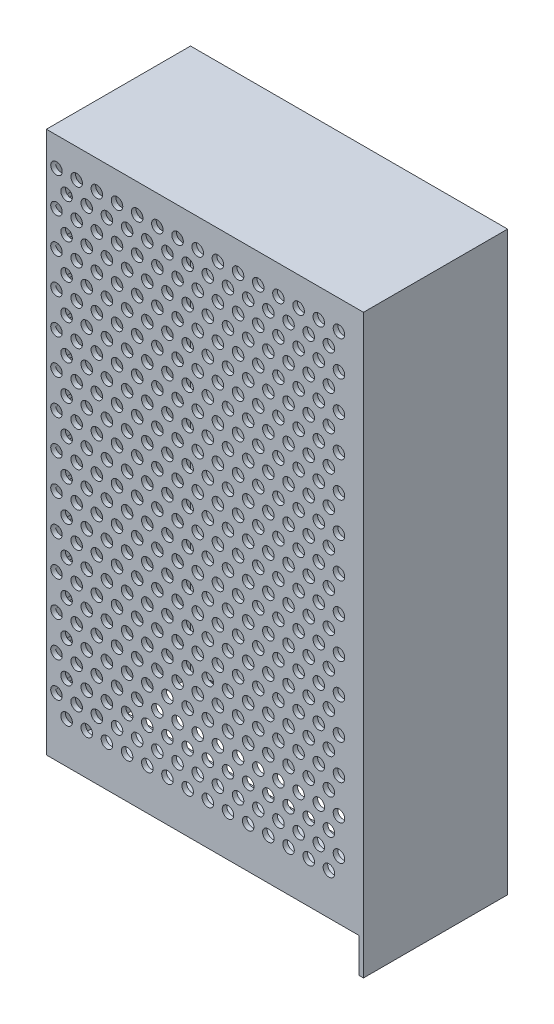
from build123d import *

# Parameters (mm, degrees)
SKETCH1_W           = 110
SKETCH1_H           = 200
BOSS_EXTRUDE1_DEPTH = 50
SHELL1_T            = -1.6
CUT_EXTRUDE1_DEPTH  = 48.4
SKETCH3_W           = 110
SKETCH3_H           = 1.6
BOSS_EXTRUDE2_DEPTH = 25
SKETCH5_R           = 1.5
CUT_EXTRUDE3_DEPTH  = 1.6
SKETCH6_R           = 2
CUT_EXTRUDE4_DEPTH  = 10


with BuildPart() as part:
    # Sketch1 → Boss-Extrude1 (new body)
    with BuildSketch(Plane.XY):
        Rectangle(SKETCH1_W, SKETCH1_H)
    extrude(amount=BOSS_EXTRUDE1_DEPTH)

    # Shell1
    shell1_openings = [part.faces().sort_by_distance(p)[0] for p in [
        (0, -100, 25),
    ]]
    offset(amount=SHELL1_T, openings=shell1_openings, kind=Kind.INTERSECTION)

    # Sketch2 → Cut-Extrude1 (cut)
    with BuildSketch(Plane.XY.offset(50)):
        Polygon((-53.4, -100), (53.4, -100), (53.4, -88), (-53.4, -88), (-55, -88), (-55, -100), align=None)
    extrude(amount=-CUT_EXTRUDE1_DEPTH, mode=Mode.SUBTRACT)

    # Sketch3 → Boss-Extrude2 (add)
    with BuildSketch(Plane.XY.offset(50)):
        with Locations((0, -87.2)):
            Rectangle(SKETCH3_W, SKETCH3_H)
    extrude(amount=-BOSS_EXTRUDE2_DEPTH)

    # Sketch5 → Cut-Extrude3 (cut)
    with BuildSketch(Plane(origin=(0, 0, 0), x_dir=(-1, 0, 0), z_dir=(0, 0, -1))):
        with Locations((-46, 90)):
            Circle(SKETCH5_R)
        with Locations((46, 90)):
            Circle(SKETCH5_R)
        with Locations((-46, -87)):
            Circle(SKETCH5_R)
        with Locations((46, -87)):
            Circle(SKETCH5_R)
    extrude(amount=-CUT_EXTRUDE3_DEPTH, mode=Mode.SUBTRACT)

    # Sketch6 → Cut-Extrude4 (cut)
    with BuildSketch(Plane.XY.offset(50)):
        with Locations((-51.5, 90)):
            Circle(SKETCH6_R)
        with Locations((-44.5, 90)):
            Circle(SKETCH6_R)
        with Locations((-37.5, 90)):
            Circle(SKETCH6_R)
        with Locations((-30.5, 90)):
            Circle(SKETCH6_R)
        with Locations((-23.5, 90)):
            Circle(SKETCH6_R)
        with Locations((-16.5, 90)):
            Circle(SKETCH6_R)
        with Locations((-9.5, 90)):
            Circle(SKETCH6_R)
        with Locations((-2.5, 90)):
            Circle(SKETCH6_R)
        with Locations((4.5, 90)):
            Circle(SKETCH6_R)
        with Locations((11.5, 90)):
            Circle(SKETCH6_R)
        with Locations((18.5, 90)):
            Circle(SKETCH6_R)
        with Locations((25.5, 90)):
            Circle(SKETCH6_R)
        with Locations((32.5, 90)):
            Circle(SKETCH6_R)
        with Locations((39.5, 90)):
            Circle(SKETCH6_R)
        with Locations((46.5, 90)):
            Circle(SKETCH6_R)
        with Locations((-48, 83.937822174)):
            Circle(SKETCH6_R)
        with Locations((-41, 83.937822174)):
            Circle(SKETCH6_R)
        with Locations((-34, 83.937822174)):
            Circle(SKETCH6_R)
        with Locations((-27, 83.937822174)):
            Circle(SKETCH6_R)
        with Locations((-20, 83.937822174)):
            Circle(SKETCH6_R)
        with Locations((-13, 83.937822174)):
            Circle(SKETCH6_R)
        with Locations((-6, 83.937822174)):
            Circle(SKETCH6_R)
        with Locations((1, 83.937822174)):
            Circle(SKETCH6_R)
        with Locations((8, 83.937822174)):
            Circle(SKETCH6_R)
        with Locations((15, 83.937822174)):
            Circle(SKETCH6_R)
        with Locations((22, 83.937822174)):
            Circle(SKETCH6_R)
        with Locations((29, 83.937822174)):
            Circle(SKETCH6_R)
        with Locations((36, 83.937822174)):
            Circle(SKETCH6_R)
        with Locations((43, 83.937822174)):
            Circle(SKETCH6_R)
        with Locations((-51.5, 77.875644347)):
            Circle(SKETCH6_R)
        with Locations((-44.5, 77.875644347)):
            Circle(SKETCH6_R)
        with Locations((-37.5, 77.875644347)):
            Circle(SKETCH6_R)
        with Locations((-30.5, 77.875644347)):
            Circle(SKETCH6_R)
        with Locations((-23.5, 77.875644347)):
            Circle(SKETCH6_R)
        with Locations((-16.5, 77.875644347)):
            Circle(SKETCH6_R)
        with Locations((-9.5, 77.875644347)):
            Circle(SKETCH6_R)
        with Locations((-2.5, 77.875644347)):
            Circle(SKETCH6_R)
        with Locations((4.5, 77.875644347)):
            Circle(SKETCH6_R)
        with Locations((11.5, 77.875644347)):
            Circle(SKETCH6_R)
        with Locations((18.5, 77.875644347)):
            Circle(SKETCH6_R)
        with Locations((25.5, 77.875644347)):
            Circle(SKETCH6_R)
        with Locations((32.5, 77.875644347)):
            Circle(SKETCH6_R)
        with Locations((39.5, 77.875644347)):
            Circle(SKETCH6_R)
        with Locations((46.5, 77.875644347)):
            Circle(SKETCH6_R)
        with Locations((-48, 71.813466521)):
            Circle(SKETCH6_R)
        with Locations((-41, 71.813466521)):
            Circle(SKETCH6_R)
        with Locations((-34, 71.813466521)):
            Circle(SKETCH6_R)
        with Locations((-27, 71.813466521)):
            Circle(SKETCH6_R)
        with Locations((-20, 71.813466521)):
            Circle(SKETCH6_R)
        with Locations((-13, 71.813466521)):
            Circle(SKETCH6_R)
        with Locations((-6, 71.813466521)):
            Circle(SKETCH6_R)
        with Locations((1, 71.813466521)):
            Circle(SKETCH6_R)
        with Locations((8, 71.813466521)):
            Circle(SKETCH6_R)
        with Locations((15, 71.813466521)):
            Circle(SKETCH6_R)
        with Locations((22, 71.813466521)):
            Circle(SKETCH6_R)
        with Locations((29, 71.813466521)):
            Circle(SKETCH6_R)
        with Locations((36, 71.813466521)):
            Circle(SKETCH6_R)
        with Locations((43, 71.813466521)):
            Circle(SKETCH6_R)
        with Locations((-51.5, 65.751288694)):
            Circle(SKETCH6_R)
        with Locations((-44.5, 65.751288694)):
            Circle(SKETCH6_R)
        with Locations((-37.5, 65.751288694)):
            Circle(SKETCH6_R)
        with Locations((-30.5, 65.751288694)):
            Circle(SKETCH6_R)
        with Locations((-23.5, 65.751288694)):
            Circle(SKETCH6_R)
        with Locations((-16.5, 65.751288694)):
            Circle(SKETCH6_R)
        with Locations((-9.5, 65.751288694)):
            Circle(SKETCH6_R)
        with Locations((-2.5, 65.751288694)):
            Circle(SKETCH6_R)
        with Locations((4.5, 65.751288694)):
            Circle(SKETCH6_R)
        with Locations((11.5, 65.751288694)):
            Circle(SKETCH6_R)
        with Locations((18.5, 65.751288694)):
            Circle(SKETCH6_R)
        with Locations((25.5, 65.751288694)):
            Circle(SKETCH6_R)
        with Locations((32.5, 65.751288694)):
            Circle(SKETCH6_R)
        with Locations((39.5, 65.751288694)):
            Circle(SKETCH6_R)
        with Locations((46.5, 65.751288694)):
            Circle(SKETCH6_R)
        with Locations((-48, 59.689110868)):
            Circle(SKETCH6_R)
        with Locations((-41, 59.689110868)):
            Circle(SKETCH6_R)
        with Locations((-34, 59.689110868)):
            Circle(SKETCH6_R)
        with Locations((-27, 59.689110868)):
            Circle(SKETCH6_R)
        with Locations((-20, 59.689110868)):
            Circle(SKETCH6_R)
        with Locations((-13, 59.689110868)):
            Circle(SKETCH6_R)
        with Locations((-6, 59.689110868)):
            Circle(SKETCH6_R)
        with Locations((1, 59.689110868)):
            Circle(SKETCH6_R)
        with Locations((8, 59.689110868)):
            Circle(SKETCH6_R)
        with Locations((15, 59.689110868)):
            Circle(SKETCH6_R)
        with Locations((22, 59.689110868)):
            Circle(SKETCH6_R)
        with Locations((29, 59.689110868)):
            Circle(SKETCH6_R)
        with Locations((36, 59.689110868)):
            Circle(SKETCH6_R)
        with Locations((43, 59.689110868)):
            Circle(SKETCH6_R)
        with Locations((-51.5, 53.626933041)):
            Circle(SKETCH6_R)
        with Locations((-44.5, 53.626933041)):
            Circle(SKETCH6_R)
        with Locations((-37.5, 53.626933041)):
            Circle(SKETCH6_R)
        with Locations((-30.5, 53.626933041)):
            Circle(SKETCH6_R)
        with Locations((-23.5, 53.626933041)):
            Circle(SKETCH6_R)
        with Locations((-16.5, 53.626933041)):
            Circle(SKETCH6_R)
        with Locations((-9.5, 53.626933041)):
            Circle(SKETCH6_R)
        with Locations((-2.5, 53.626933041)):
            Circle(SKETCH6_R)
        with Locations((4.5, 53.626933041)):
            Circle(SKETCH6_R)
        with Locations((11.5, 53.626933041)):
            Circle(SKETCH6_R)
        with Locations((18.5, 53.626933041)):
            Circle(SKETCH6_R)
        with Locations((25.5, 53.626933041)):
            Circle(SKETCH6_R)
        with Locations((32.5, 53.626933041)):
            Circle(SKETCH6_R)
        with Locations((39.5, 53.626933041)):
            Circle(SKETCH6_R)
        with Locations((46.5, 53.626933041)):
            Circle(SKETCH6_R)
        with Locations((-48, 47.564755215)):
            Circle(SKETCH6_R)
        with Locations((-41, 47.564755215)):
            Circle(SKETCH6_R)
        with Locations((-34, 47.564755215)):
            Circle(SKETCH6_R)
        with Locations((-27, 47.564755215)):
            Circle(SKETCH6_R)
        with Locations((-20, 47.564755215)):
            Circle(SKETCH6_R)
        with Locations((-13, 47.564755215)):
            Circle(SKETCH6_R)
        with Locations((-6, 47.564755215)):
            Circle(SKETCH6_R)
        with Locations((1, 47.564755215)):
            Circle(SKETCH6_R)
        with Locations((8, 47.564755215)):
            Circle(SKETCH6_R)
        with Locations((15, 47.564755215)):
            Circle(SKETCH6_R)
        with Locations((22, 47.564755215)):
            Circle(SKETCH6_R)
        with Locations((29, 47.564755215)):
            Circle(SKETCH6_R)
        with Locations((36, 47.564755215)):
            Circle(SKETCH6_R)
        with Locations((43, 47.564755215)):
            Circle(SKETCH6_R)
        with Locations((-51.5, 41.502577388)):
            Circle(SKETCH6_R)
        with Locations((-44.5, 41.502577388)):
            Circle(SKETCH6_R)
        with Locations((-37.5, 41.502577388)):
            Circle(SKETCH6_R)
        with Locations((-30.5, 41.502577388)):
            Circle(SKETCH6_R)
        with Locations((-23.5, 41.502577388)):
            Circle(SKETCH6_R)
        with Locations((-16.5, 41.502577388)):
            Circle(SKETCH6_R)
        with Locations((-9.5, 41.502577388)):
            Circle(SKETCH6_R)
        with Locations((-2.5, 41.502577388)):
            Circle(SKETCH6_R)
        with Locations((4.5, 41.502577388)):
            Circle(SKETCH6_R)
        with Locations((11.5, 41.502577388)):
            Circle(SKETCH6_R)
        with Locations((18.5, 41.502577388)):
            Circle(SKETCH6_R)
        with Locations((25.5, 41.502577388)):
            Circle(SKETCH6_R)
        with Locations((32.5, 41.502577388)):
            Circle(SKETCH6_R)
        with Locations((39.5, 41.502577388)):
            Circle(SKETCH6_R)
        with Locations((46.5, 41.502577388)):
            Circle(SKETCH6_R)
        with Locations((-48, 35.440399562)):
            Circle(SKETCH6_R)
        with Locations((-41, 35.440399562)):
            Circle(SKETCH6_R)
        with Locations((-34, 35.440399562)):
            Circle(SKETCH6_R)
        with Locations((-27, 35.440399562)):
            Circle(SKETCH6_R)
        with Locations((-20, 35.440399562)):
            Circle(SKETCH6_R)
        with Locations((-13, 35.440399562)):
            Circle(SKETCH6_R)
        with Locations((-6, 35.440399562)):
            Circle(SKETCH6_R)
        with Locations((1, 35.440399562)):
            Circle(SKETCH6_R)
        with Locations((8, 35.440399562)):
            Circle(SKETCH6_R)
        with Locations((15, 35.440399562)):
            Circle(SKETCH6_R)
        with Locations((22, 35.440399562)):
            Circle(SKETCH6_R)
        with Locations((29, 35.440399562)):
            Circle(SKETCH6_R)
        with Locations((36, 35.440399562)):
            Circle(SKETCH6_R)
        with Locations((43, 35.440399562)):
            Circle(SKETCH6_R)
        with Locations((-51.5, 29.378221735)):
            Circle(SKETCH6_R)
        with Locations((-44.5, 29.378221735)):
            Circle(SKETCH6_R)
        with Locations((-37.5, 29.378221735)):
            Circle(SKETCH6_R)
        with Locations((-30.5, 29.378221735)):
            Circle(SKETCH6_R)
        with Locations((-23.5, 29.378221735)):
            Circle(SKETCH6_R)
        with Locations((-16.5, 29.378221735)):
            Circle(SKETCH6_R)
        with Locations((-9.5, 29.378221735)):
            Circle(SKETCH6_R)
        with Locations((-2.5, 29.378221735)):
            Circle(SKETCH6_R)
        with Locations((4.5, 29.378221735)):
            Circle(SKETCH6_R)
        with Locations((11.5, 29.378221735)):
            Circle(SKETCH6_R)
        with Locations((18.5, 29.378221735)):
            Circle(SKETCH6_R)
        with Locations((25.5, 29.378221735)):
            Circle(SKETCH6_R)
        with Locations((32.5, 29.378221735)):
            Circle(SKETCH6_R)
        with Locations((39.5, 29.378221735)):
            Circle(SKETCH6_R)
        with Locations((46.5, 29.378221735)):
            Circle(SKETCH6_R)
        with Locations((-48, 23.316043909)):
            Circle(SKETCH6_R)
        with Locations((-41, 23.316043909)):
            Circle(SKETCH6_R)
        with Locations((-34, 23.316043909)):
            Circle(SKETCH6_R)
        with Locations((-27, 23.316043909)):
            Circle(SKETCH6_R)
        with Locations((-20, 23.316043909)):
            Circle(SKETCH6_R)
        with Locations((-13, 23.316043909)):
            Circle(SKETCH6_R)
        with Locations((-6, 23.316043909)):
            Circle(SKETCH6_R)
        with Locations((1, 23.316043909)):
            Circle(SKETCH6_R)
        with Locations((8, 23.316043909)):
            Circle(SKETCH6_R)
        with Locations((15, 23.316043909)):
            Circle(SKETCH6_R)
        with Locations((22, 23.316043909)):
            Circle(SKETCH6_R)
        with Locations((29, 23.316043909)):
            Circle(SKETCH6_R)
        with Locations((36, 23.316043909)):
            Circle(SKETCH6_R)
        with Locations((43, 23.316043909)):
            Circle(SKETCH6_R)
        with Locations((-51.5, 17.253866082)):
            Circle(SKETCH6_R)
        with Locations((-44.5, 17.253866082)):
            Circle(SKETCH6_R)
        with Locations((-37.5, 17.253866082)):
            Circle(SKETCH6_R)
        with Locations((-30.5, 17.253866082)):
            Circle(SKETCH6_R)
        with Locations((-23.5, 17.253866082)):
            Circle(SKETCH6_R)
        with Locations((-16.5, 17.253866082)):
            Circle(SKETCH6_R)
        with Locations((-9.5, 17.253866082)):
            Circle(SKETCH6_R)
        with Locations((-2.5, 17.253866082)):
            Circle(SKETCH6_R)
        with Locations((4.5, 17.253866082)):
            Circle(SKETCH6_R)
        with Locations((11.5, 17.253866082)):
            Circle(SKETCH6_R)
        with Locations((18.5, 17.253866082)):
            Circle(SKETCH6_R)
        with Locations((25.5, 17.253866082)):
            Circle(SKETCH6_R)
        with Locations((32.5, 17.253866082)):
            Circle(SKETCH6_R)
        with Locations((39.5, 17.253866082)):
            Circle(SKETCH6_R)
        with Locations((46.5, 17.253866082)):
            Circle(SKETCH6_R)
        with Locations((-48, 11.191688256)):
            Circle(SKETCH6_R)
        with Locations((-41, 11.191688256)):
            Circle(SKETCH6_R)
        with Locations((-34, 11.191688256)):
            Circle(SKETCH6_R)
        with Locations((-27, 11.191688256)):
            Circle(SKETCH6_R)
        with Locations((-20, 11.191688256)):
            Circle(SKETCH6_R)
        with Locations((-13, 11.191688256)):
            Circle(SKETCH6_R)
        with Locations((-6, 11.191688256)):
            Circle(SKETCH6_R)
        with Locations((1, 11.191688256)):
            Circle(SKETCH6_R)
        with Locations((8, 11.191688256)):
            Circle(SKETCH6_R)
        with Locations((15, 11.191688256)):
            Circle(SKETCH6_R)
        with Locations((22, 11.191688256)):
            Circle(SKETCH6_R)
        with Locations((29, 11.191688256)):
            Circle(SKETCH6_R)
        with Locations((36, 11.191688256)):
            Circle(SKETCH6_R)
        with Locations((43, 11.191688256)):
            Circle(SKETCH6_R)
        with Locations((-51.5, 5.129510429)):
            Circle(SKETCH6_R)
        with Locations((-44.5, 5.129510429)):
            Circle(SKETCH6_R)
        with Locations((-37.5, 5.129510429)):
            Circle(SKETCH6_R)
        with Locations((-30.5, 5.129510429)):
            Circle(SKETCH6_R)
        with Locations((-23.5, 5.129510429)):
            Circle(SKETCH6_R)
        with Locations((-16.5, 5.129510429)):
            Circle(SKETCH6_R)
        with Locations((-9.5, 5.129510429)):
            Circle(SKETCH6_R)
        with Locations((-2.5, 5.129510429)):
            Circle(SKETCH6_R)
        with Locations((4.5, 5.129510429)):
            Circle(SKETCH6_R)
        with Locations((11.5, 5.129510429)):
            Circle(SKETCH6_R)
        with Locations((18.5, 5.129510429)):
            Circle(SKETCH6_R)
        with Locations((25.5, 5.129510429)):
            Circle(SKETCH6_R)
        with Locations((32.5, 5.129510429)):
            Circle(SKETCH6_R)
        with Locations((39.5, 5.129510429)):
            Circle(SKETCH6_R)
        with Locations((46.5, 5.129510429)):
            Circle(SKETCH6_R)
        with Locations((-48, -0.932667397)):
            Circle(SKETCH6_R)
        with Locations((-41, -0.932667397)):
            Circle(SKETCH6_R)
        with Locations((-34, -0.932667397)):
            Circle(SKETCH6_R)
        with Locations((-27, -0.932667397)):
            Circle(SKETCH6_R)
        with Locations((-20, -0.932667397)):
            Circle(SKETCH6_R)
        with Locations((-13, -0.932667397)):
            Circle(SKETCH6_R)
        with Locations((-6, -0.932667397)):
            Circle(SKETCH6_R)
        with Locations((1, -0.932667397)):
            Circle(SKETCH6_R)
        with Locations((8, -0.932667397)):
            Circle(SKETCH6_R)
        with Locations((15, -0.932667397)):
            Circle(SKETCH6_R)
        with Locations((22, -0.932667397)):
            Circle(SKETCH6_R)
        with Locations((29, -0.932667397)):
            Circle(SKETCH6_R)
        with Locations((36, -0.932667397)):
            Circle(SKETCH6_R)
        with Locations((43, -0.932667397)):
            Circle(SKETCH6_R)
        with Locations((-51.5, -6.994845224)):
            Circle(SKETCH6_R)
        with Locations((-44.5, -6.994845224)):
            Circle(SKETCH6_R)
        with Locations((-37.5, -6.994845224)):
            Circle(SKETCH6_R)
        with Locations((-30.5, -6.994845224)):
            Circle(SKETCH6_R)
        with Locations((-23.5, -6.994845224)):
            Circle(SKETCH6_R)
        with Locations((-16.5, -6.994845224)):
            Circle(SKETCH6_R)
        with Locations((-9.5, -6.994845224)):
            Circle(SKETCH6_R)
        with Locations((-2.5, -6.994845224)):
            Circle(SKETCH6_R)
        with Locations((4.5, -6.994845224)):
            Circle(SKETCH6_R)
        with Locations((11.5, -6.994845224)):
            Circle(SKETCH6_R)
        with Locations((18.5, -6.994845224)):
            Circle(SKETCH6_R)
        with Locations((25.5, -6.994845224)):
            Circle(SKETCH6_R)
        with Locations((32.5, -6.994845224)):
            Circle(SKETCH6_R)
        with Locations((39.5, -6.994845224)):
            Circle(SKETCH6_R)
        with Locations((46.5, -6.994845224)):
            Circle(SKETCH6_R)
        with Locations((-48, -13.05702305)):
            Circle(SKETCH6_R)
        with Locations((-41, -13.05702305)):
            Circle(SKETCH6_R)
        with Locations((-34, -13.05702305)):
            Circle(SKETCH6_R)
        with Locations((-27, -13.05702305)):
            Circle(SKETCH6_R)
        with Locations((-20, -13.05702305)):
            Circle(SKETCH6_R)
        with Locations((-13, -13.05702305)):
            Circle(SKETCH6_R)
        with Locations((-6, -13.05702305)):
            Circle(SKETCH6_R)
        with Locations((1, -13.05702305)):
            Circle(SKETCH6_R)
        with Locations((8, -13.05702305)):
            Circle(SKETCH6_R)
        with Locations((15, -13.05702305)):
            Circle(SKETCH6_R)
        with Locations((22, -13.05702305)):
            Circle(SKETCH6_R)
        with Locations((29, -13.05702305)):
            Circle(SKETCH6_R)
        with Locations((36, -13.05702305)):
            Circle(SKETCH6_R)
        with Locations((43, -13.05702305)):
            Circle(SKETCH6_R)
        with Locations((-51.5, -19.119200877)):
            Circle(SKETCH6_R)
        with Locations((-44.5, -19.119200877)):
            Circle(SKETCH6_R)
        with Locations((-37.5, -19.119200877)):
            Circle(SKETCH6_R)
        with Locations((-30.5, -19.119200877)):
            Circle(SKETCH6_R)
        with Locations((-23.5, -19.119200877)):
            Circle(SKETCH6_R)
        with Locations((-16.5, -19.119200877)):
            Circle(SKETCH6_R)
        with Locations((-9.5, -19.119200877)):
            Circle(SKETCH6_R)
        with Locations((-2.5, -19.119200877)):
            Circle(SKETCH6_R)
        with Locations((4.5, -19.119200877)):
            Circle(SKETCH6_R)
        with Locations((11.5, -19.119200877)):
            Circle(SKETCH6_R)
        with Locations((18.5, -19.119200877)):
            Circle(SKETCH6_R)
        with Locations((25.5, -19.119200877)):
            Circle(SKETCH6_R)
        with Locations((32.5, -19.119200877)):
            Circle(SKETCH6_R)
        with Locations((39.5, -19.119200877)):
            Circle(SKETCH6_R)
        with Locations((46.5, -19.119200877)):
            Circle(SKETCH6_R)
        with Locations((-48, -25.181378703)):
            Circle(SKETCH6_R)
        with Locations((-41, -25.181378703)):
            Circle(SKETCH6_R)
        with Locations((-34, -25.181378703)):
            Circle(SKETCH6_R)
        with Locations((-27, -25.181378703)):
            Circle(SKETCH6_R)
        with Locations((-20, -25.181378703)):
            Circle(SKETCH6_R)
        with Locations((-13, -25.181378703)):
            Circle(SKETCH6_R)
        with Locations((-6, -25.181378703)):
            Circle(SKETCH6_R)
        with Locations((1, -25.181378703)):
            Circle(SKETCH6_R)
        with Locations((8, -25.181378703)):
            Circle(SKETCH6_R)
        with Locations((15, -25.181378703)):
            Circle(SKETCH6_R)
        with Locations((22, -25.181378703)):
            Circle(SKETCH6_R)
        with Locations((29, -25.181378703)):
            Circle(SKETCH6_R)
        with Locations((36, -25.181378703)):
            Circle(SKETCH6_R)
        with Locations((43, -25.181378703)):
            Circle(SKETCH6_R)
        with Locations((-51.5, -31.24355653)):
            Circle(SKETCH6_R)
        with Locations((-44.5, -31.24355653)):
            Circle(SKETCH6_R)
        with Locations((-37.5, -31.24355653)):
            Circle(SKETCH6_R)
        with Locations((-30.5, -31.24355653)):
            Circle(SKETCH6_R)
        with Locations((-23.5, -31.24355653)):
            Circle(SKETCH6_R)
        with Locations((-16.5, -31.24355653)):
            Circle(SKETCH6_R)
        with Locations((-9.5, -31.24355653)):
            Circle(SKETCH6_R)
        with Locations((-2.5, -31.24355653)):
            Circle(SKETCH6_R)
        with Locations((4.5, -31.24355653)):
            Circle(SKETCH6_R)
        with Locations((11.5, -31.24355653)):
            Circle(SKETCH6_R)
        with Locations((18.5, -31.24355653)):
            Circle(SKETCH6_R)
        with Locations((25.5, -31.24355653)):
            Circle(SKETCH6_R)
        with Locations((32.5, -31.24355653)):
            Circle(SKETCH6_R)
        with Locations((39.5, -31.24355653)):
            Circle(SKETCH6_R)
        with Locations((46.5, -31.24355653)):
            Circle(SKETCH6_R)
        with Locations((-48, -37.305734356)):
            Circle(SKETCH6_R)
        with Locations((-41, -37.305734356)):
            Circle(SKETCH6_R)
        with Locations((-34, -37.305734356)):
            Circle(SKETCH6_R)
        with Locations((-27, -37.305734356)):
            Circle(SKETCH6_R)
        with Locations((-20, -37.305734356)):
            Circle(SKETCH6_R)
        with Locations((-13, -37.305734356)):
            Circle(SKETCH6_R)
        with Locations((-6, -37.305734356)):
            Circle(SKETCH6_R)
        with Locations((1, -37.305734356)):
            Circle(SKETCH6_R)
        with Locations((8, -37.305734356)):
            Circle(SKETCH6_R)
        with Locations((15, -37.305734356)):
            Circle(SKETCH6_R)
        with Locations((22, -37.305734356)):
            Circle(SKETCH6_R)
        with Locations((29, -37.305734356)):
            Circle(SKETCH6_R)
        with Locations((36, -37.305734356)):
            Circle(SKETCH6_R)
        with Locations((43, -37.305734356)):
            Circle(SKETCH6_R)
        with Locations((-51.5, -43.367912183)):
            Circle(SKETCH6_R)
        with Locations((-44.5, -43.367912183)):
            Circle(SKETCH6_R)
        with Locations((-37.5, -43.367912183)):
            Circle(SKETCH6_R)
        with Locations((-30.5, -43.367912183)):
            Circle(SKETCH6_R)
        with Locations((-23.5, -43.367912183)):
            Circle(SKETCH6_R)
        with Locations((-16.5, -43.367912183)):
            Circle(SKETCH6_R)
        with Locations((-9.5, -43.367912183)):
            Circle(SKETCH6_R)
        with Locations((-2.5, -43.367912183)):
            Circle(SKETCH6_R)
        with Locations((4.5, -43.367912183)):
            Circle(SKETCH6_R)
        with Locations((11.5, -43.367912183)):
            Circle(SKETCH6_R)
        with Locations((18.5, -43.367912183)):
            Circle(SKETCH6_R)
        with Locations((25.5, -43.367912183)):
            Circle(SKETCH6_R)
        with Locations((32.5, -43.367912183)):
            Circle(SKETCH6_R)
        with Locations((39.5, -43.367912183)):
            Circle(SKETCH6_R)
        with Locations((46.5, -43.367912183)):
            Circle(SKETCH6_R)
        with Locations((-48, -49.430090009)):
            Circle(SKETCH6_R)
        with Locations((-41, -49.430090009)):
            Circle(SKETCH6_R)
        with Locations((-34, -49.430090009)):
            Circle(SKETCH6_R)
        with Locations((-27, -49.430090009)):
            Circle(SKETCH6_R)
        with Locations((-20, -49.430090009)):
            Circle(SKETCH6_R)
        with Locations((-13, -49.430090009)):
            Circle(SKETCH6_R)
        with Locations((-6, -49.430090009)):
            Circle(SKETCH6_R)
        with Locations((1, -49.430090009)):
            Circle(SKETCH6_R)
        with Locations((8, -49.430090009)):
            Circle(SKETCH6_R)
        with Locations((15, -49.430090009)):
            Circle(SKETCH6_R)
        with Locations((22, -49.430090009)):
            Circle(SKETCH6_R)
        with Locations((29, -49.430090009)):
            Circle(SKETCH6_R)
        with Locations((36, -49.430090009)):
            Circle(SKETCH6_R)
        with Locations((43, -49.430090009)):
            Circle(SKETCH6_R)
        with Locations((-51.5, -55.492267836)):
            Circle(SKETCH6_R)
        with Locations((-44.5, -55.492267836)):
            Circle(SKETCH6_R)
        with Locations((-37.5, -55.492267836)):
            Circle(SKETCH6_R)
        with Locations((-30.5, -55.492267836)):
            Circle(SKETCH6_R)
        with Locations((-23.5, -55.492267836)):
            Circle(SKETCH6_R)
        with Locations((-16.5, -55.492267836)):
            Circle(SKETCH6_R)
        with Locations((-9.5, -55.492267836)):
            Circle(SKETCH6_R)
        with Locations((-2.5, -55.492267836)):
            Circle(SKETCH6_R)
        with Locations((4.5, -55.492267836)):
            Circle(SKETCH6_R)
        with Locations((11.5, -55.492267836)):
            Circle(SKETCH6_R)
        with Locations((18.5, -55.492267836)):
            Circle(SKETCH6_R)
        with Locations((25.5, -55.492267836)):
            Circle(SKETCH6_R)
        with Locations((32.5, -55.492267836)):
            Circle(SKETCH6_R)
        with Locations((39.5, -55.492267836)):
            Circle(SKETCH6_R)
        with Locations((46.5, -55.492267836)):
            Circle(SKETCH6_R)
        with Locations((-48, -61.554445662)):
            Circle(SKETCH6_R)
        with Locations((-41, -61.554445662)):
            Circle(SKETCH6_R)
        with Locations((-34, -61.554445662)):
            Circle(SKETCH6_R)
        with Locations((-27, -61.554445662)):
            Circle(SKETCH6_R)
        with Locations((-20, -61.554445662)):
            Circle(SKETCH6_R)
        with Locations((-13, -61.554445662)):
            Circle(SKETCH6_R)
        with Locations((-6, -61.554445662)):
            Circle(SKETCH6_R)
        with Locations((1, -61.554445662)):
            Circle(SKETCH6_R)
        with Locations((8, -61.554445662)):
            Circle(SKETCH6_R)
        with Locations((15, -61.554445662)):
            Circle(SKETCH6_R)
        with Locations((22, -61.554445662)):
            Circle(SKETCH6_R)
        with Locations((29, -61.554445662)):
            Circle(SKETCH6_R)
        with Locations((36, -61.554445662)):
            Circle(SKETCH6_R)
        with Locations((43, -61.554445662)):
            Circle(SKETCH6_R)
        with Locations((-51.5, -67.616623489)):
            Circle(SKETCH6_R)
        with Locations((-44.5, -67.616623489)):
            Circle(SKETCH6_R)
        with Locations((-37.5, -67.616623489)):
            Circle(SKETCH6_R)
        with Locations((-30.5, -67.616623489)):
            Circle(SKETCH6_R)
        with Locations((-23.5, -67.616623489)):
            Circle(SKETCH6_R)
        with Locations((-16.5, -67.616623489)):
            Circle(SKETCH6_R)
        with Locations((-9.5, -67.616623489)):
            Circle(SKETCH6_R)
        with Locations((-2.5, -67.616623489)):
            Circle(SKETCH6_R)
        with Locations((4.5, -67.616623489)):
            Circle(SKETCH6_R)
        with Locations((11.5, -67.616623489)):
            Circle(SKETCH6_R)
        with Locations((18.5, -67.616623489)):
            Circle(SKETCH6_R)
        with Locations((25.5, -67.616623489)):
            Circle(SKETCH6_R)
        with Locations((32.5, -67.616623489)):
            Circle(SKETCH6_R)
        with Locations((39.5, -67.616623489)):
            Circle(SKETCH6_R)
        with Locations((46.5, -67.616623489)):
            Circle(SKETCH6_R)
        with Locations((-48, -73.678801315)):
            Circle(SKETCH6_R)
        with Locations((-41, -73.678801315)):
            Circle(SKETCH6_R)
        with Locations((-34, -73.678801315)):
            Circle(SKETCH6_R)
        with Locations((-27, -73.678801315)):
            Circle(SKETCH6_R)
        with Locations((-20, -73.678801315)):
            Circle(SKETCH6_R)
        with Locations((-13, -73.678801315)):
            Circle(SKETCH6_R)
        with Locations((-6, -73.678801315)):
            Circle(SKETCH6_R)
        with Locations((1, -73.678801315)):
            Circle(SKETCH6_R)
        with Locations((8, -73.678801315)):
            Circle(SKETCH6_R)
        with Locations((15, -73.678801315)):
            Circle(SKETCH6_R)
        with Locations((22, -73.678801315)):
            Circle(SKETCH6_R)
        with Locations((29, -73.678801315)):
            Circle(SKETCH6_R)
        with Locations((36, -73.678801315)):
            Circle(SKETCH6_R)
        with Locations((43, -73.678801315)):
            Circle(SKETCH6_R)
    extrude(amount=-CUT_EXTRUDE4_DEPTH, mode=Mode.SUBTRACT)


solid = part.part
